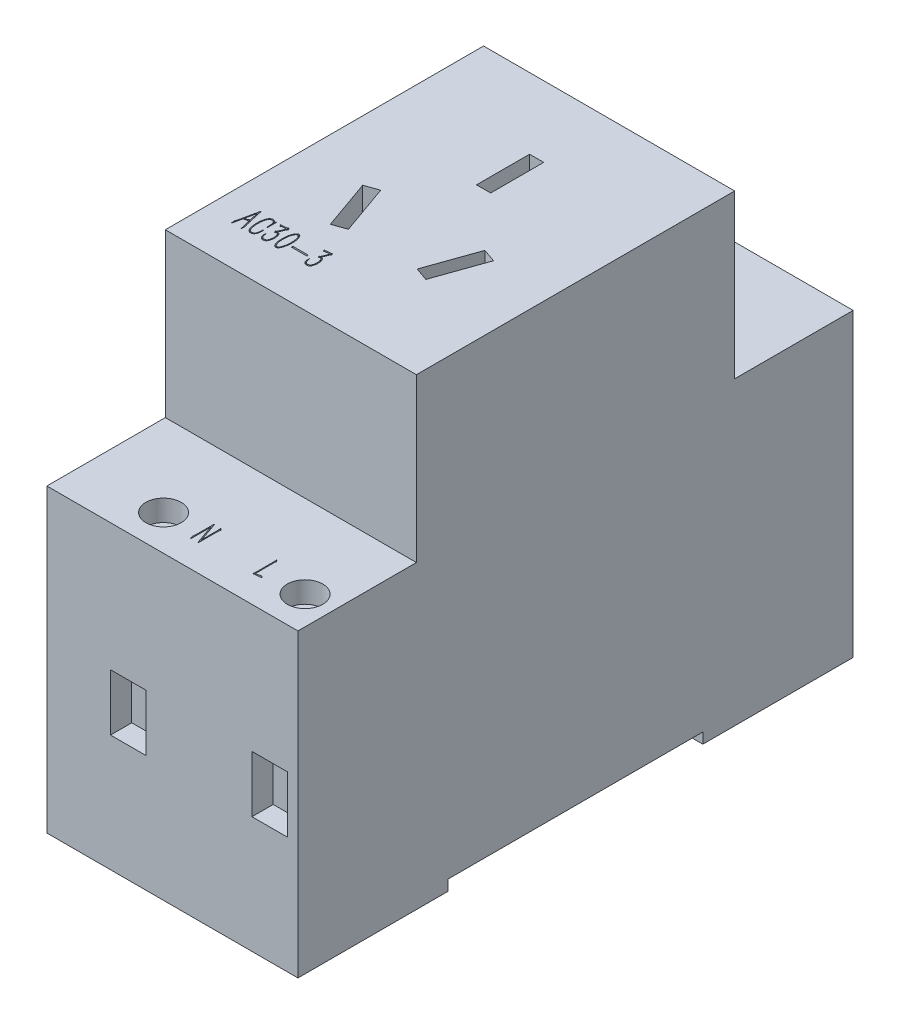
from build123d import *

# Parameters (mm, degrees)
EXTRUDE_1_DEPTH        = 17.75
SKETCH_2_R             = 2.5
CUT_EXTRUDE_1_DEPTH    = 3
SKETCH_3_W             = 5
SKETCH_3_H             = 8
CUT_EXTRUDE_2_DEPTH    = 3
PATTERN_LINEAR_1_COUNT = 3
PATTERN_LINEAR_1_PITCH = 20
SKETCH_5_R             = 3
CUT_EXTRUDE_3_DEPTH    = 3
SKETCH_6_W             = 5
SKETCH_6_H             = 8
CUT_EXTRUDE_4_DEPTH    = 3
SKETCH_9_W             = 2.164287236
SKETCH_9_H             = 0.217025357
CUT_EXTRUDE_6_DEPTH    = 0.3
CUT_EXTRUDE_7_DEPTH    = 0.3
SKETCH_14_W            = 2
SKETCH_14_H            = 7.5
CUT_EXTRUDE_8_DEPTH    = 5


with BuildPart() as part:
    # 草图1 → 凸台-拉伸1 (new, symmetric)
    with BuildSketch(Plane(origin=(0, 0, 0), x_dir=(0, 0, -1), z_dir=(1, 0, 0))):
        Polygon((-22.5, 32.75), (-22.5, 9.75), (-39.25, 9.75), (-39.25, -32.75), (-22.5, -32.75), (-18, -32.75), (-18, -31.25), (18, -31.25), (18, -32.75), (22.5, -32.75), (39.25, -32.75), (39.25, 9.75), (22.5, 9.75), (22.5, 32.75), align=None)
    extrude(amount=EXTRUDE_1_DEPTH, both=True)

    # 草图2 → 切除-拉伸1 (cut)
    with BuildSketch(Plane(origin=(0, 9.75, 0), x_dir=(1, 0, 0), z_dir=(0, 1, 0))):
        with Locations((-6.25, -34.25)):
            Circle(SKETCH_2_R)
    cut_extrude_1 = extrude(amount=-CUT_EXTRUDE_1_DEPTH, mode=Mode.SUBTRACT)

    # 草图3 → 切除-拉伸2 (cut)
    with BuildSketch(Plane.XY.offset(39.25)):
        with Locations((-6.25, -12.25)):
            Rectangle(SKETCH_3_W, SKETCH_3_H)
    cut_extrude_2 = extrude(amount=-CUT_EXTRUDE_2_DEPTH, mode=Mode.SUBTRACT)

    # 阵列(线性)1: 切除-拉伸1, 切除-拉伸2 ×3
    with Locations(*[(i * PATTERN_LINEAR_1_PITCH, 0, 0) for i in range(1, PATTERN_LINEAR_1_COUNT)]):
        add(cut_extrude_1, mode=Mode.SUBTRACT)
        add(cut_extrude_2, mode=Mode.SUBTRACT)

    # 草图5 → 切除-拉伸3 (cut)
    with BuildSketch(Plane(origin=(0, 9.75, 0), x_dir=(1, 0, 0), z_dir=(0, 1, 0))):
        with Locations((0, 30.875)):
            Circle(SKETCH_5_R)
    extrude(amount=-CUT_EXTRUDE_3_DEPTH, mode=Mode.SUBTRACT)

    # 草图6 → 切除-拉伸4 (cut)
    with BuildSketch(Plane(origin=(0, 0, -39.25), x_dir=(-1, 0, 0), z_dir=(0, 0, -1))):
        with Locations((0.051136376, -12.435750671)):
            Rectangle(SKETCH_6_W, SKETCH_6_H)
    extrude(amount=-CUT_EXTRUDE_4_DEPTH, mode=Mode.SUBTRACT)

    # 草图9 → 切除-拉伸6 (cut)
    # profile 1 of 6: a face of its own
    with BuildSketch(Plane(origin=(0, 32.75, 0), x_dir=(1, 0, 0), z_dir=(0, 1, 0))):
        with BuildLine():
            Line((-12.903846154, -15.517259749), (-13.588482847, -15.682825485))
            Line((-13.588482847, -15.682825485), (-13.749573833, -16.433091839))
            Line((-13.749573833, -16.433091839), (-13.825644577, -16.815682932))
            Line((-13.825644577, -16.815682932), (-13.855476241, -16.936501172))
            add(Edge.make_bspline(
                [(-13.855476241, -16.936501172), (-13.85864397, -16.945059256), (-13.863986048, -16.959491663), (-13.874037779, -16.97647154), (-13.88506828, -16.98490966), (-13.89738396, -16.98668845), (-13.906623365, -16.976009255), (-13.912117538, -16.962475291), (-13.913762051, -16.942614008), (-13.918331734, -16.916755356), (-13.921189485, -16.879763732), (-13.924468618, -16.851712187), (-13.926326444, -16.835819305)],
                knots=[0, 0, 0, 0, 1.226577759, 2.068508672, 2.595953142, 3.064162245, 3.560072257, 4.322224954, 5.029865969, 6.20926766, 7.852322798, 10, 10, 10, 10], degree=3))
            Line((-13.926326444, -16.835819305), (-13.950937567, -16.624760281))
            add(Edge.make_bspline(
                [(-13.950937567, -16.624760281), (-13.952528405, -16.607368105), (-13.955366473, -16.576340333), (-13.957860132, -16.535289216), (-13.958022043, -16.505671284), (-13.956586828, -16.480893098), (-13.949249484, -16.457460972), (-13.940532766, -16.441402394), (-13.936021734, -16.433091839)],
                knots=[0, 0, 0, 0, 1.603576797, 2.86079302, 3.773774944, 4.323462854, 5.1323669, 6, 6, 6, 6], degree=3))
            Line((-13.936021734, -16.433091839), (-13.91066482, -16.387598551))
            add(Edge.make_bspline(
                [(-13.91066482, -16.387598551), (-13.905234051, -16.375749704), (-13.892264208, -16.347452114), (-13.875841933, -16.295357842), (-13.858345759, -16.227530288), (-13.840715847, -16.149461978), (-13.823434547, -16.073859556), (-13.809628871, -16.012257796), (-13.79903273, -15.971395967), (-13.792141348, -15.951292584), (-13.78984658, -15.944598338)],
                knots=[0, 0, 0, 0, 0.679694972, 1.623257572, 2.844174753, 4.335796169, 5.799225578, 6.891200865, 7.630779852, 8, 8, 8, 8], degree=3))
            Line((-13.78984658, -15.944598338), (-13.271521415, -13.543895163))
            Line((-13.271521415, -13.543895163), (-13.201417004, -13.543895163))
            Line((-13.201417004, -13.543895163), (-12.712923503, -15.702961858))
            Line((-12.712923503, -15.702961858), (-12.652514383, -15.95503942))
            add(Edge.make_bspline(
                [(-12.652514383, -15.95503942), (-12.646454785, -15.98341577), (-12.635584754, -16.034318782), (-12.619043657, -16.101920209), (-12.605477696, -16.152543791), (-12.595938582, -16.180301036), (-12.592105263, -16.191455359)],
                knots=[0, 0, 0, 0, 1.425899692, 2.557855139, 3.420470246, 4, 4, 4, 4], degree=3))
            Line((-12.592105263, -16.191455359), (-12.557053058, -16.286916684))
            add(Edge.make_bspline(
                [(-12.557053058, -16.286916684), (-12.553018292, -16.300900397), (-12.545667104, -16.326378181), (-12.533109763, -16.360097705), (-12.520768714, -16.386133792), (-12.505055502, -16.40806158), (-12.489116806, -16.42451921), (-12.478115071, -16.441586532), (-12.476725188, -16.457519374), (-12.478652254, -16.472125844), (-12.480710195, -16.490728918), (-12.481711538, -16.514153121), (-12.484369821, -16.546426333), (-12.485544096, -16.570809028), (-12.486202855, -16.584487535)],
                knots=[0, 0, 0, 0, 1.645080438, 2.997272953, 4.065812928, 4.892545225, 6.029861332, 6.67147811, 7.124734071, 7.80170629, 8.338742145, 9.240009017, 10.451666043, 12, 12, 12, 12], degree=3))
            Line((-12.486202855, -16.584487535), (-12.506339229, -16.810462391))
            Line((-12.506339229, -16.810462391), (-12.516780311, -16.896228425))
            add(Edge.make_bspline(
                [(-12.516780311, -16.896228425), (-12.517276735, -16.905954831), (-12.51815915, -16.923243947), (-12.522413177, -16.9455144), (-12.525198303, -16.961680016), (-12.531065911, -16.973375317), (-12.542213852, -16.979158277), (-12.556034167, -16.975124678), (-12.566656291, -16.96114578), (-12.570012176, -16.948875905), (-12.57196889, -16.941721713)],
                knots=[0, 0, 0, 0, 1.663187075, 2.956388731, 3.874273883, 4.464983498, 5.130530035, 5.83179128, 6.735783313, 8, 8, 8, 8], degree=3))
            Line((-12.57196889, -16.941721713), (-12.607021095, -16.74035798))
            Line((-12.607021095, -16.74035798), (-12.903846154, -15.517259749))
        make_face()
        with BuildLine():
            Line((-12.914287236, -15.441189005), (-13.236469209, -14.027168123))
            Line((-13.236469209, -14.027168123), (-13.563871724, -15.506818666))
            add(Edge.make_bspline(
                [(-13.563871724, -15.506818666), (-13.535469746, -15.502440871), (-13.486436445, -15.494883025), (-13.41809484, -15.479873252), (-13.353414001, -15.462106351), (-13.295976991, -15.446213948), (-13.248533158, -15.430091389), (-13.217534101, -15.419423278), (-13.193983916, -15.408400165), (-13.181457775, -15.400042808), (-13.176060089, -15.396441509)],
                knots=[0, 0, 0, 0, 1.70172219, 2.937860729, 4.141475294, 5.674569601, 6.46612829, 7.108957565, 7.616037637, 8, 8, 8, 8], degree=3))
            Line((-13.176060089, -15.396441509), (-13.050021308, -15.310675474))
            Line((-13.050021308, -15.310675474), (-12.914287236, -15.441189005))
        make_face(mode=Mode.SUBTRACT)
    # profile 2 of 6: a face of its own
    with BuildSketch(Plane(origin=(0, 32.75, 0), x_dir=(1, 0, 0), z_dir=(0, 1, 0))):
        with BuildLine():
            Line((-10.904378862, -13.95631792), (-10.868580865, -13.659492862))
            Line((-10.868580865, -13.659492862), (-10.793255913, -13.659492862))
            Line((-10.793255913, -13.659492862), (-10.793255913, -15.003409333))
            Line((-10.793255913, -15.003409333), (-10.888717238, -15.003409333))
            add(Edge.make_bspline(
                [(-10.888717238, -15.003409333), (-10.888847848, -14.979044476), (-10.889121111, -14.928068106), (-10.892037466, -14.846552828), (-10.893899059, -14.753560188), (-10.897067392, -14.648656873), (-10.900044643, -14.536336662), (-10.911034693, -14.421325542), (-10.927835803, -14.305088994), (-10.953475464, -14.188496192), (-10.987192223, -14.07606274), (-11.027029876, -13.990486403), (-11.064226621, -13.930399112), (-11.094696643, -13.891337922), (-11.128660136, -13.858056011), (-11.17726281, -13.821844688), (-11.243643297, -13.785362539), (-11.302385557, -13.775029591), (-11.331717452, -13.769870019)],
                knots=[0, 0, 0, 0, 0.822473136, 1.720785642, 2.753326599, 3.962261781, 5.264018637, 6.545024146, 7.860049611, 9.226346671, 10.572050264, 11.814683136, 12.399128484, 12.954850798, 13.483022901, 13.998303406, 15.000488703, 16, 16, 16, 16], degree=3))
            add(Edge.make_bspline(
                [(-11.331717452, -13.769870019), (-11.354143012, -13.769271775), (-11.398899814, -13.768077803), (-11.465441677, -13.78153376), (-11.5295427, -13.806647815), (-11.591041957, -13.843038343), (-11.649627026, -13.88980444), (-11.701586298, -13.949631437), (-11.750993572, -14.018313232), (-11.791970529, -14.098736511), (-11.828282205, -14.185169663), (-11.862059777, -14.275097553), (-11.888257563, -14.368823702), (-11.916595397, -14.496167199), (-11.941791887, -14.654143397), (-11.959894779, -14.838036678), (-11.969357046, -15.009759192), (-11.972687096, -15.169969078), (-11.969397926, -15.323937552), (-11.963932839, -15.425540075), (-11.961165566, -15.476987002)],
                knots=[0, 0, 0, 0, 0.603095173, 1.203653813, 1.814626149, 2.451293107, 3.123130818, 3.825388984, 4.580186105, 5.398460658, 6.251023789, 7.107448911, 7.985514538, 8.871470416, 10.622993602, 12.29317529, 13.850163291, 15.257553743, 16.61134915, 18, 18, 18, 18], degree=3))
            add(Edge.make_bspline(
                [(-11.961165566, -15.476987002), (-11.957141866, -15.522995358), (-11.948908502, -15.617138444), (-11.935205272, -15.736565277), (-11.919361046, -15.837660378), (-11.903651215, -15.920968012), (-11.884068867, -16.01118983), (-11.862097319, -16.104859171), (-11.837368362, -16.194473438), (-11.814149264, -16.273940978), (-11.7907446, -16.338840519), (-11.759948785, -16.405831128), (-11.716377041, -16.476136539), (-11.659774013, -16.551912506), (-11.596301728, -16.614607183), (-11.528252898, -16.662330049), (-11.452330352, -16.690068949), (-11.399313201, -16.693233701), (-11.371990198, -16.694864692)],
                knots=[0, 0, 0, 0, 1.515526627, 3.101096572, 3.943353373, 4.87293365, 5.882541642, 6.972773351, 8.029529644, 8.932786276, 9.68898916, 10.291221641, 11.348890653, 12.39638072, 13.388602443, 14.264213047, 15.105442077, 16, 16, 16, 16], degree=3))
            add(Edge.make_bspline(
                [(-11.371990198, -16.694864692), (-11.346527409, -16.695208185), (-11.294674824, -16.695907677), (-11.217443973, -16.676266369), (-11.14247369, -16.644890815), (-11.072446322, -16.598563452), (-11.010660198, -16.537059595), (-10.958112807, -16.460530153), (-10.916442554, -16.369383439), (-10.88764843, -16.265259683), (-10.864417756, -16.152922142), (-10.8493168, -16.057057999), (-10.838631024, -15.984603481), (-10.831716929, -15.941164633), (-10.827381182, -15.908790746), (-10.824836991, -15.891148616), (-10.823833369, -15.884189218)],
                knots=[0, 0, 0, 0, 0.974493461, 1.984464659, 3.032762083, 4.086915356, 5.187622472, 6.361151533, 7.634420725, 9.018373663, 10.501751059, 12.040324543, 12.745324753, 13.31527632, 13.729892907, 14, 14, 14, 14], degree=3))
            Line((-10.823833369, -15.884189218), (-10.798476454, -15.617941615))
            Line((-10.798476454, -15.617941615), (-10.717930961, -15.622416365))
            add(Edge.make_bspline(
                [(-10.717930961, -15.622416365), (-10.717830566, -15.647277054), (-10.71764784, -15.692525025), (-10.7187584, -15.754169806), (-10.718975964, -15.803166407), (-10.720973755, -15.843168215), (-10.72227045, -15.880744115), (-10.725535527, -15.922752306), (-10.729959326, -15.972728249), (-10.737927194, -16.04648763), (-10.745948906, -16.134889966), (-10.75717445, -16.233853206), (-10.773886367, -16.330548493), (-10.805245267, -16.431476186), (-10.84841565, -16.537427687), (-10.89717708, -16.621968331), (-10.943658318, -16.684516727), (-10.984338133, -16.726189058), (-11.029478025, -16.764207942), (-11.079787196, -16.79633569), (-11.132877233, -16.82334811), (-11.188190392, -16.842512316), (-11.244270908, -16.856907128), (-11.282657255, -16.859751443), (-11.301885787, -16.86117622)],
                knots=[0, 0, 0, 0, 1.082557886, 1.97032136, 2.684891572, 3.215786613, 3.714233695, 4.322010655, 5.050226996, 5.899051791, 7.552532718, 8.915438272, 10.236158893, 11.818471953, 13.507262255, 15.209909354, 16.052150521, 16.894322113, 17.739826851, 18.616631911, 19.488074199, 20.326969254, 21.161943562, 22, 22, 22, 22], degree=3))
            add(Edge.make_bspline(
                [(-11.301885787, -16.86117622), (-11.334050628, -16.862585178), (-11.399565549, -16.865455014), (-11.496210279, -16.843418682), (-11.586608298, -16.808503478), (-11.655440284, -16.768347901), (-11.704540688, -16.728515916), (-11.739551677, -16.691874136), (-11.774934462, -16.650134448), (-11.808813171, -16.601399335), (-11.842696464, -16.546904213), (-11.874262394, -16.485821366), (-11.904841922, -16.419016663), (-11.945779572, -16.320406991), (-11.989917752, -16.183864194), (-12.025126669, -16.038146746), (-12.048806336, -15.912130644), (-12.063059337, -15.809238509), (-12.076783779, -15.700396125), (-12.091312004, -15.548809972), (-12.103284604, -15.360340153), (-12.109405029, -15.137664793), (-12.10295544, -14.91702744), (-12.085595764, -14.770629558), (-12.076763264, -14.696143192)],
                knots=[0, 0, 0, 0, 0.828879423, 1.68830212, 2.536676829, 3.328986324, 3.73541648, 4.167069034, 4.63682846, 5.148487351, 5.699502401, 6.294435402, 6.924061178, 7.598240742, 9.053084533, 10.627089957, 11.470192478, 12.366164513, 13.311378798, 14.305576584, 16.301598498, 18.191207909, 20.062109376, 22, 22, 22, 22], degree=3))
            add(Edge.make_bspline(
                [(-12.076763264, -14.696143192), (-12.066684952, -14.621572919), (-12.046627654, -14.4731673), (-12.001872225, -14.293125126), (-11.959270715, -14.157641548), (-11.926168816, -14.067297649), (-11.891019476, -13.988695545), (-11.854984339, -13.920173424), (-11.816294568, -13.86049449), (-11.775616892, -13.80689251), (-11.730194445, -13.760843292), (-11.683968265, -13.719981273), (-11.63754957, -13.686636805), (-11.594886975, -13.658971495), (-11.557311696, -13.636621594), (-11.510656473, -13.617115821), (-11.449222561, -13.602097789), (-11.39868657, -13.603541579), (-11.371990198, -13.604304283)],
                knots=[0, 0, 0, 0, 2.546659555, 5.068220541, 6.268960188, 7.35572531, 8.324149365, 9.182807276, 9.974388089, 10.730435642, 11.456747585, 12.160764052, 12.817438768, 13.389505863, 13.883390408, 14.294592413, 15.099093679, 16, 16, 16, 16], degree=3))
            add(Edge.make_bspline(
                [(-11.371990198, -13.604304283), (-11.344691369, -13.608978906), (-11.288740769, -13.618559829), (-11.206921855, -13.64857607), (-11.126119375, -13.69001941), (-11.056179263, -13.74852705), (-10.994316757, -13.808975937), (-10.963427117, -13.854634298), (-10.949126358, -13.875772427)],
                knots=[0, 0, 0, 0, 0.959137923, 1.965811105, 3.01152559, 4.09188384, 5.116612916, 6, 6, 6, 6], degree=3))
            Line((-10.949126358, -13.875772427), (-10.904378862, -13.95631792))
        make_face()
    # profile 3 of 6: a face of its own
    with BuildSketch(Plane(origin=(0, 32.75, 0), x_dir=(1, 0, 0), z_dir=(0, 1, 0))):
        with BuildLine():
            add(Edge.make_bspline(
                [(-9.699179629, -14.832623056), (-9.688007995, -14.809496011), (-9.666487303, -14.764944784), (-9.635097354, -14.700591841), (-9.605813392, -14.641507765), (-9.580766768, -14.586681307), (-9.55741193, -14.537321203), (-9.536611422, -14.492899036), (-9.518638382, -14.453400283), (-9.499716567, -14.409548209), (-9.480091755, -14.36380032), (-9.461093289, -14.318991432), (-9.44727738, -14.286983409), (-9.440134527, -14.270050493), (-9.437406776, -14.263584061)],
                knots=[0, 0, 0, 0, 1.475873638, 2.843077615, 4.114458223, 5.26483622, 6.306479236, 7.252326145, 8.083448402, 8.799989154, 9.996708352, 10.943956596, 11.596712522, 12, 12, 12, 12], degree=3))
            Line((-9.437406776, -14.263584061), (-9.276315789, -13.83549968))
            add(Edge.make_bspline(
                [(-9.276315789, -13.83549968), (-9.311351946, -13.838928371), (-9.387799113, -13.846409606), (-9.48535917, -13.852349721), (-9.566476861, -13.856675542), (-9.622137467, -13.861339664), (-9.670877275, -13.865699087), (-9.700924265, -13.869015711), (-9.714841253, -13.870551886)],
                knots=[0, 0, 0, 0, 1.440114021, 3.142257811, 3.998086789, 4.76330671, 5.427195687, 6, 6, 6, 6], degree=3))
            Line((-9.714841253, -13.870551886), (-9.865491157, -13.8959088))
            add(Edge.make_bspline(
                [(-9.865491157, -13.8959088), (-9.872222602, -13.897323976), (-9.890587823, -13.901184961), (-9.924550787, -13.911728117), (-9.973463727, -13.924693766), (-10.010693143, -13.935356299), (-10.031802685, -13.941402088)],
                knots=[0, 0, 0, 0, 0.478461291, 1.305373098, 2.472113022, 4, 4, 4, 4], degree=3))
            Line((-10.031802685, -13.941402088), (-10.081770722, -13.961538462))
            Line((-10.081770722, -13.961538462), (-10.207809504, -13.77509056))
            add(Edge.make_bspline(
                [(-10.207809504, -13.77509056), (-10.213131701, -13.767790732), (-10.222217261, -13.755329146), (-10.229759894, -13.737993825), (-10.235358692, -13.72595056), (-10.230340656, -13.713822976), (-10.210497867, -13.715641528), (-10.19551626, -13.726278227), (-10.17638056, -13.736512097), (-10.154364508, -13.737951427), (-10.127673257, -13.739517838), (-10.108110909, -13.73647747), (-10.097432346, -13.734817814)],
                knots=[0, 0, 0, 0, 1.323589942, 2.259509366, 2.829398404, 3.190947808, 3.965341466, 5.19662492, 6.050472624, 7.088782, 8.410843841, 10, 10, 10, 10], degree=3))
            Line((-10.097432346, -13.734817814), (-9.936341359, -13.729597273))
            Line((-9.936341359, -13.729597273), (-9.301672704, -13.65427232))
            Line((-9.301672704, -13.65427232), (-9.251704667, -13.608779033))
            Line((-9.251704667, -13.608779033), (-9.21143192, -13.568506286))
            add(Edge.make_bspline(
                [(-9.21143192, -13.568506286), (-9.210182944, -13.569993019), (-9.205062836, -13.576087798), (-9.194040159, -13.590590628), (-9.174440297, -13.613891368), (-9.159621929, -13.633308961), (-9.1510228, -13.64457703)],
                knots=[0, 0, 0, 0, 0.23984028, 0.983211964, 2.249351781, 4, 4, 4, 4], degree=3))
            Line((-9.1510228, -13.64457703), (-9.054815683, -13.76539527))
            add(Edge.make_bspline(
                [(-9.054815683, -13.76539527), (-9.048355223, -13.773783312), (-9.037618963, -13.787722909), (-9.029653937, -13.810016338), (-9.037815652, -13.82512065), (-9.049217075, -13.838067786), (-9.067698844, -13.853618288), (-9.082342046, -13.864439317), (-9.09061368, -13.870551886)],
                knots=[0, 0, 0, 0, 1.419029252, 2.358201718, 2.827787952, 3.596253847, 4.642174893, 6, 6, 6, 6], degree=3))
            Line((-9.09061368, -13.870551886), (-9.145802259, -13.916045174))
            add(Edge.make_bspline(
                [(-9.145802259, -13.916045174), (-9.161930793, -13.956578471), (-9.192532423, -14.033484713), (-9.236623308, -14.142935579), (-9.276968269, -14.240253133), (-9.31239394, -14.326287286), (-9.344932917, -14.400060178), (-9.371795766, -14.462658281), (-9.395981072, -14.512879656), (-9.410774072, -14.542278227), (-9.417270403, -14.555188579)],
                knots=[0, 0, 0, 0, 1.507300768, 2.859891598, 4.076963614, 5.147345159, 6.074452096, 6.862861548, 7.500626815, 8, 8, 8, 8], degree=3))
            Line((-9.417270403, -14.555188579), (-9.568666098, -14.842318346))
            add(Edge.make_bspline(
                [(-9.568666098, -14.842318346), (-9.55077064, -14.8408895), (-9.51649768, -14.838153008), (-9.46419291, -14.832929177), (-9.407203857, -14.84011451), (-9.357219528, -14.860105118), (-9.314691589, -14.884771996), (-9.280613943, -14.909409359), (-9.248057892, -14.941431036), (-9.214860727, -14.979074857), (-9.181586015, -15.024004711), (-9.150998082, -15.078423989), (-9.119156435, -15.140565939), (-9.079334787, -15.235269274), (-9.0363058, -15.361984268), (-9.010162087, -15.52113901), (-8.997245092, -15.680595693), (-8.995348784, -15.786714377), (-8.994406563, -15.839441722)],
                knots=[0, 0, 0, 0, 0.660541429, 1.265053373, 1.928435853, 2.750244091, 3.225390118, 3.735570922, 4.291687282, 4.900607759, 5.580848831, 6.342918567, 7.193367346, 8.147740655, 10.119512469, 12.097611575, 14.061014616, 16, 16, 16, 16], degree=3))
            add(Edge.make_bspline(
                [(-8.994406563, -15.839441722), (-8.996396925, -15.880721601), (-9.000177974, -15.959140118), (-9.009315874, -16.069951499), (-9.022952287, -16.167167426), (-9.042811388, -16.276769954), (-9.077834368, -16.397859178), (-9.121100816, -16.509575171), (-9.162181655, -16.590060186), (-9.19680367, -16.643429303), (-9.234724653, -16.6911748), (-9.275475694, -16.732957284), (-9.317865185, -16.767293719), (-9.359006124, -16.796824178), (-9.400636578, -16.817695346), (-9.454530928, -16.835131144), (-9.520391111, -16.847149747), (-9.572845914, -16.849557621), (-9.598497763, -16.850735137)],
                knots=[0, 0, 0, 0, 1.512752116, 2.8737433, 4.067977017, 5.104892351, 6.948544146, 8.672095895, 9.482011449, 10.251829035, 10.996496654, 11.710742831, 12.38300564, 12.991319199, 13.561044299, 14.079002633, 15.060579187, 16, 16, 16, 16], degree=3))
            add(Edge.make_bspline(
                [(-9.598497763, -16.850735137), (-9.620377698, -16.851108091), (-9.662472183, -16.85182561), (-9.723529129, -16.846855109), (-9.779138583, -16.83547854), (-9.831291016, -16.820002461), (-9.88013346, -16.795528833), (-9.92678744, -16.760568347), (-9.97375304, -16.717518531), (-10.01878365, -16.664688541), (-10.059996278, -16.604162867), (-10.096031514, -16.537213204), (-10.125971834, -16.464787362), (-10.155736289, -16.361715429), (-10.180964188, -16.229916753), (-10.185458607, -16.123212995), (-10.18767313, -16.070637119)],
                knots=[0, 0, 0, 0, 0.828828519, 1.594571005, 2.314948186, 2.97625877, 3.650192192, 4.371738268, 5.178272596, 6.059897072, 6.995131469, 7.947518938, 8.935744196, 9.957858231, 12.008325587, 14, 14, 14, 14], degree=3))
            Line((-10.18767313, -16.070637119), (-10.192893671, -15.874493927))
            Line((-10.192893671, -15.874493927), (-10.137705093, -15.874493927))
            add(Edge.make_bspline(
                [(-10.137705093, -15.874493927), (-10.133484895, -15.903580402), (-10.125402843, -15.959283581), (-10.113646568, -16.039649112), (-10.101470256, -16.112907738), (-10.087747893, -16.199602325), (-10.064893736, -16.296950996), (-10.026391451, -16.401723578), (-9.974176959, -16.4902498), (-9.912870717, -16.563201481), (-9.841169414, -16.616153574), (-9.764411982, -16.649554655), (-9.686182303, -16.665325211), (-9.634350078, -16.665129149), (-9.608938845, -16.665033028)],
                knots=[0, 0, 0, 0, 0.994021113, 1.903638599, 2.746793397, 3.505624798, 4.871908371, 6.122639036, 7.264652637, 8.331625701, 9.323760524, 10.250011688, 11.142051883, 12, 12, 12, 12], degree=3))
            add(Edge.make_bspline(
                [(-9.608938845, -16.665033028), (-9.58849589, -16.663270178), (-9.548456646, -16.659817489), (-9.490395396, -16.646672736), (-9.436700419, -16.624243739), (-9.386506286, -16.595561937), (-9.34132656, -16.558159879), (-9.300664563, -16.514088042), (-9.266229052, -16.461731756), (-9.227636545, -16.381577308), (-9.190130551, -16.271073813), (-9.16191027, -16.130715034), (-9.143546871, -15.987545354), (-9.134919846, -15.845092224), (-9.133744369, -15.704751157), (-9.145284256, -15.612902298), (-9.1510228, -15.567227786)],
                knots=[0, 0, 0, 0, 0.647840119, 1.268849254, 1.871153999, 2.479976942, 3.088343857, 3.716462885, 4.367721208, 5.059616847, 6.52246665, 8.039623249, 9.575767262, 11.078710543, 12.547304005, 14, 14, 14, 14], degree=3))
            add(Edge.make_bspline(
                [(-9.1510228, -15.567227786), (-9.159046982, -15.517997394), (-9.174908942, -15.420680239), (-9.211600718, -15.303871136), (-9.247731885, -15.216647063), (-9.279967159, -15.158126652), (-9.316504434, -15.105854079), (-9.35789187, -15.0620123), (-9.399847121, -15.02603529), (-9.441959003, -15.002028728), (-9.483546708, -14.989675469), (-9.51019516, -14.992391399), (-9.523172811, -14.993714042)],
                knots=[0, 0, 0, 0, 2.019199264, 3.991492233, 4.943861116, 5.841091039, 6.693606335, 7.520378909, 8.278781735, 8.923571305, 9.475785111, 10, 10, 10, 10], degree=3))
            Line((-9.523172811, -14.993714042), (-9.603718304, -15.003409333))
            Line((-9.603718304, -15.003409333), (-9.638770509, -15.069038994))
            add(Edge.make_bspline(
                [(-9.638770509, -15.069038994), (-9.643449035, -15.077218085), (-9.651604853, -15.091476247), (-9.662749691, -15.110322325), (-9.671650935, -15.121360908), (-9.678407181, -15.130876976), (-9.688173896, -15.127675758), (-9.694455865, -15.116736788), (-9.70449817, -15.100633091), (-9.711030596, -15.086802366), (-9.714841253, -15.078734285)],
                knots=[0, 0, 0, 0, 1.659028505, 2.892093886, 3.763458346, 4.288089223, 4.647361994, 5.327919393, 6.441255868, 8, 8, 8, 8], degree=3))
            Line((-9.714841253, -15.078734285), (-9.795386746, -14.92286384))
            add(Edge.make_bspline(
                [(-9.795386746, -14.92286384), (-9.801208731, -14.913905413), (-9.811358111, -14.89828832), (-9.80695808, -14.880486129), (-9.805082037, -14.872895802)],
                knots=[0, 0, 0, 0, 1.147259222, 2, 2, 2, 2], degree=3))
            Line((-9.805082037, -14.872895802), (-9.76480929, -14.857234179))
            Line((-9.76480929, -14.857234179), (-9.699179629, -14.832623056))
        make_face()
    # profile 4 of 6: a face of its own
    with BuildSketch(Plane(origin=(0, 32.75, 0), x_dir=(1, 0, 0), z_dir=(0, 1, 0))):
        with BuildLine():
            add(Edge.make_bspline(
                [(-8.404485404, -15.179416152), (-8.402055012, -15.131169164), (-8.397075596, -15.032320124), (-8.383539112, -14.880807899), (-8.363572356, -14.722745507), (-8.340418532, -14.560418531), (-8.308379877, -14.400062182), (-8.267376398, -14.247564625), (-8.215032182, -14.106567459), (-8.162800844, -13.998299694), (-8.118646844, -13.918919111), (-8.086520593, -13.866113237), (-8.05595694, -13.818491335), (-8.025844727, -13.777116713), (-7.996289493, -13.741885261), (-7.969032067, -13.711336604), (-7.941523275, -13.687553006), (-7.907023267, -13.663969388), (-7.865029322, -13.642935301), (-7.816366196, -13.624534304), (-7.769541628, -13.613889912), (-7.73903773, -13.613963889), (-7.72432346, -13.613999574)],
                knots=[0, 0, 0, 0, 1.583211401, 3.243703523, 4.983978234, 6.804605119, 8.6166428, 10.340282122, 11.974804003, 13.53820457, 14.274983449, 14.951299633, 15.563740824, 16.129235462, 16.626851747, 17.070813204, 17.469389546, 17.815167281, 18.438300608, 19.002855301, 19.519003895, 20, 20, 20, 20], degree=3))
            add(Edge.make_bspline(
                [(-7.72432346, -13.613999574), (-7.710253274, -13.616459908), (-7.680534851, -13.621656516), (-7.636598894, -13.640978515), (-7.589967204, -13.666674607), (-7.540353527, -13.699979022), (-7.490818991, -13.744758612), (-7.444912298, -13.804067884), (-7.402293658, -13.876501231), (-7.349331055, -13.991138172), (-7.29096806, -14.146520746), (-7.245141726, -14.309670215), (-7.215374367, -14.445892431), (-7.195961287, -14.554575747), (-7.18052478, -14.669823427), (-7.163948421, -14.831839255), (-7.149165355, -15.039446829), (-7.146782777, -15.206733422), (-7.145589175, -15.290539101)],
                knots=[0, 0, 0, 0, 0.36369769, 0.768186139, 1.217229854, 1.724510149, 2.290946358, 2.914777825, 3.632489608, 4.433551378, 6.137860108, 7.866765886, 8.757390638, 9.699141408, 10.686159515, 11.726895222, 13.859299765, 16, 16, 16, 16], degree=3))
            add(Edge.make_bspline(
                [(-7.145589175, -15.290539101), (-7.150154718, -15.357691673), (-7.15953786, -15.495704217), (-7.181859816, -15.70707598), (-7.218674837, -15.926967987), (-7.265001874, -16.112195287), (-7.309811645, -16.259675847), (-7.347811882, -16.366096437), (-7.390329951, -16.46659545), (-7.435709948, -16.560198932), (-7.482919303, -16.643523155), (-7.531788115, -16.713539633), (-7.583427645, -16.767466406), (-7.636480487, -16.806202039), (-7.688279775, -16.832452611), (-7.737773742, -16.849236861), (-7.784907023, -16.858553366), (-7.815530067, -16.856798046), (-7.830225868, -16.855955679)],
                knots=[0, 0, 0, 0, 1.760488992, 3.618172134, 5.557361062, 7.587083219, 8.607294374, 9.588398617, 10.541277716, 11.460251193, 12.307925722, 13.044175775, 13.687957546, 14.251129358, 14.754223989, 15.200440537, 15.616296545, 16, 16, 16, 16], degree=3))
            add(Edge.make_bspline(
                [(-7.830225868, -16.855955679), (-7.844268116, -16.853981824), (-7.873854049, -16.849823063), (-7.918450431, -16.83232251), (-7.964891658, -16.80535887), (-8.014470863, -16.769815252), (-8.064394383, -16.720983648), (-8.11246779, -16.657823334), (-8.158569544, -16.579991114), (-8.202381479, -16.488971783), (-8.243531571, -16.387591742), (-8.279563665, -16.278201112), (-8.312946683, -16.163249762), (-8.339695472, -16.043062084), (-8.361706895, -15.921593071), (-8.378977465, -15.802194541), (-8.391095534, -15.686263306), (-8.39763534, -15.574261754), (-8.399922139, -15.467046052), (-8.40233896, -15.365622522), (-8.403850897, -15.270406715), (-8.404279109, -15.208999618), (-8.404485404, -15.179416152)],
                knots=[0, 0, 0, 0, 0.451175502, 0.950591959, 1.515271951, 2.162531354, 2.891688268, 3.734081857, 4.687580886, 5.773002708, 6.954198864, 8.17563603, 9.445923076, 10.771603705, 12.101713585, 13.383756751, 14.619631726, 15.819374781, 16.961914306, 18.040825747, 19.056148764, 20, 20, 20, 20], degree=3))
        make_face()
        with BuildLine():
            add(Edge.make_bspline(
                [(-8.273226081, -15.189857234), (-8.273756826, -15.213970051), (-8.274883874, -15.265174096), (-8.275955732, -15.346727177), (-8.273956108, -15.437473764), (-8.270539411, -15.571384315), (-8.257995395, -15.7463886), (-8.225935178, -15.956489317), (-8.180147053, -16.159955169), (-8.129692676, -16.319394452), (-8.082720039, -16.433052669), (-8.046675247, -16.503593055), (-8.008754823, -16.560580067), (-7.969025706, -16.603987537), (-7.928838716, -16.634749719), (-7.891282488, -16.656731719), (-7.855693291, -16.671826187), (-7.831841974, -16.67379474), (-7.820530577, -16.674728319)],
                knots=[0, 0, 0, 0, 0.705717407, 1.498604912, 2.386138873, 3.361274458, 5.418191474, 7.514713171, 9.57394393, 11.515405308, 12.398906158, 13.169972934, 13.829695216, 14.395845116, 14.883250105, 15.303691084, 15.669778158, 16, 16, 16, 16], degree=3))
            add(Edge.make_bspline(
                [(-7.820530577, -16.674728319), (-7.810058765, -16.674593632), (-7.787565451, -16.674304325), (-7.752373608, -16.665841293), (-7.715376635, -16.648026329), (-7.674338683, -16.624615909), (-7.632179435, -16.588586643), (-7.590567505, -16.539348545), (-7.549781539, -16.476244239), (-7.509105169, -16.401625402), (-7.470628275, -16.318607591), (-7.436161074, -16.230653163), (-7.406165373, -16.139859638), (-7.373724766, -16.012833355), (-7.340374259, -15.848085172), (-7.310417881, -15.646900728), (-7.290551816, -15.448504119), (-7.282278646, -15.286650429), (-7.279977366, -15.158533951), (-7.281889864, -15.056584149), (-7.285498224, -14.947181255), (-7.289629831, -14.87164639), (-7.29176433, -14.832623056)],
                knots=[0, 0, 0, 0, 0.308126263, 0.661851094, 1.055455993, 1.515432549, 2.051181639, 2.679899785, 3.409545513, 4.262246801, 5.183512362, 6.104777924, 7.045624675, 8.000099589, 9.967578284, 11.997814557, 13.993544283, 15.842664909, 16.77344086, 17.770161498, 18.848005724, 20, 20, 20, 20], degree=3))
            add(Edge.make_bspline(
                [(-7.29176433, -14.832623056), (-7.295361151, -14.796066133), (-7.302342529, -14.725109673), (-7.314616316, -14.622560938), (-7.329846761, -14.527386101), (-7.351307573, -14.410132694), (-7.385950951, -14.269440377), (-7.433669756, -14.135497041), (-7.47482667, -14.034368551), (-7.510202211, -13.970294107), (-7.546181929, -13.91591731), (-7.586164445, -13.87442096), (-7.625082869, -13.842084379), (-7.66171237, -13.81791592), (-7.695924452, -13.800851831), (-7.718962652, -13.796997303), (-7.729544002, -13.795226934)],
                knots=[0, 0, 0, 0, 1.302834758, 2.528783491, 3.662347304, 4.720685654, 6.75648594, 8.792057095, 9.759925264, 10.624039914, 11.384659521, 12.06448684, 12.659424566, 13.175428451, 13.621277708, 14, 14, 14, 14], degree=3))
            add(Edge.make_bspline(
                [(-7.729544002, -13.795226934), (-7.741046472, -13.796063955), (-7.765217254, -13.797822835), (-7.802116146, -13.809133002), (-7.841279764, -13.826818368), (-7.884306405, -13.851350039), (-7.929127854, -13.890723067), (-7.974385547, -13.948357042), (-8.02121548, -14.024804688), (-8.070093394, -14.118911664), (-8.116794954, -14.229788324), (-8.156473988, -14.356787568), (-8.190761902, -14.497760912), (-8.216588401, -14.64873376), (-8.237451039, -14.79983307), (-8.253718055, -14.941858302), (-8.26618014, -15.07038295), (-8.270967295, -15.151556186), (-8.273226081, -15.189857234)],
                knots=[0, 0, 0, 0, 0.347392606, 0.729995465, 1.156884588, 1.644891073, 2.219813456, 2.945627096, 3.849684979, 4.924243867, 6.145708801, 7.477723151, 8.938118981, 10.524254447, 12.100980159, 13.544449593, 14.841364989, 16, 16, 16, 16], degree=3))
        make_face(mode=Mode.SUBTRACT)
    # profile 5 of 6: a face of its own
    with BuildSketch(Plane(origin=(0, 32.75, 0), x_dir=(1, 0, 0), z_dir=(0, 1, 0))):
        with Locations((-5.61373322, -15.610110804)):
            Rectangle(SKETCH_9_W, SKETCH_9_H)
    # profile 6 of 6: a face of its own
    with BuildSketch(Plane(origin=(0, 32.75, 0), x_dir=(1, 0, 0), z_dir=(0, 1, 0))):
        with BuildLine():
            add(Edge.make_bspline(
                [(-3.541924142, -14.832623056), (-3.530752508, -14.809496011), (-3.509231816, -14.764944784), (-3.477841867, -14.700591841), (-3.448557905, -14.641507765), (-3.423511282, -14.586681307), (-3.400156443, -14.537321203), (-3.379355935, -14.492899036), (-3.361382896, -14.453400283), (-3.342461081, -14.409548209), (-3.322836268, -14.36380032), (-3.303837802, -14.318991432), (-3.290021894, -14.286983409), (-3.28287904, -14.270050493), (-3.280151289, -14.263584061)],
                knots=[0, 0, 0, 0, 1.475873638, 2.843077615, 4.114458223, 5.26483622, 6.306479236, 7.252326145, 8.083448402, 8.799989154, 9.996708352, 10.943956596, 11.596712522, 12, 12, 12, 12], degree=3))
            Line((-3.280151289, -14.263584061), (-3.119060303, -13.83549968))
            add(Edge.make_bspline(
                [(-3.119060303, -13.83549968), (-3.154096459, -13.838928371), (-3.230543626, -13.846409606), (-3.328103683, -13.852349721), (-3.409221375, -13.856675542), (-3.46488198, -13.861339664), (-3.513621788, -13.865699087), (-3.543668778, -13.869015711), (-3.557585766, -13.870551886)],
                knots=[0, 0, 0, 0, 1.440114021, 3.142257811, 3.998086789, 4.76330671, 5.427195687, 6, 6, 6, 6], degree=3))
            Line((-3.557585766, -13.870551886), (-3.70823567, -13.8959088))
            add(Edge.make_bspline(
                [(-3.70823567, -13.8959088), (-3.714967115, -13.897323976), (-3.733332336, -13.901184961), (-3.7672953, -13.911728117), (-3.81620824, -13.924693766), (-3.853437656, -13.935356299), (-3.874547198, -13.941402088)],
                knots=[0, 0, 0, 0, 0.478461291, 1.305373098, 2.472113022, 4, 4, 4, 4], degree=3))
            Line((-3.874547198, -13.941402088), (-3.924515235, -13.961538462))
            Line((-3.924515235, -13.961538462), (-4.050554017, -13.77509056))
            add(Edge.make_bspline(
                [(-4.050554017, -13.77509056), (-4.055876214, -13.767790732), (-4.064961774, -13.755329146), (-4.072504407, -13.737993825), (-4.078103205, -13.72595056), (-4.073085169, -13.713822976), (-4.05324238, -13.715641528), (-4.038260773, -13.726278227), (-4.019125073, -13.736512097), (-3.997109022, -13.737951427), (-3.970417771, -13.739517838), (-3.950855423, -13.73647747), (-3.940176859, -13.734817814)],
                knots=[0, 0, 0, 0, 1.323589942, 2.259509366, 2.829398404, 3.190947808, 3.965341466, 5.19662492, 6.050472624, 7.088782, 8.410843841, 10, 10, 10, 10], degree=3))
            Line((-3.940176859, -13.734817814), (-3.779085873, -13.729597273))
            Line((-3.779085873, -13.729597273), (-3.144417217, -13.65427232))
            Line((-3.144417217, -13.65427232), (-3.09444918, -13.608779033))
            Line((-3.09444918, -13.608779033), (-3.054176433, -13.568506286))
            add(Edge.make_bspline(
                [(-3.054176433, -13.568506286), (-3.052927457, -13.569993019), (-3.047807349, -13.576087798), (-3.036784672, -13.590590628), (-3.01718481, -13.613891368), (-3.002366442, -13.633308961), (-2.993767313, -13.64457703)],
                knots=[0, 0, 0, 0, 0.23984028, 0.983211964, 2.249351781, 4, 4, 4, 4], degree=3))
            Line((-2.993767313, -13.64457703), (-2.897560196, -13.76539527))
            add(Edge.make_bspline(
                [(-2.897560196, -13.76539527), (-2.891099736, -13.773783312), (-2.880363476, -13.787722909), (-2.87239845, -13.810016338), (-2.880560165, -13.82512065), (-2.891961588, -13.838067786), (-2.910443357, -13.853618288), (-2.925086559, -13.864439317), (-2.933358193, -13.870551886)],
                knots=[0, 0, 0, 0, 1.419029252, 2.358201718, 2.827787952, 3.596253847, 4.642174893, 6, 6, 6, 6], degree=3))
            Line((-2.933358193, -13.870551886), (-2.988546772, -13.916045174))
            add(Edge.make_bspline(
                [(-2.988546772, -13.916045174), (-3.004675306, -13.956578471), (-3.035276936, -14.033484713), (-3.079367821, -14.142935579), (-3.119712782, -14.240253133), (-3.155138453, -14.326287286), (-3.18767743, -14.400060178), (-3.214540279, -14.462658281), (-3.238725585, -14.512879656), (-3.253518585, -14.542278227), (-3.260014916, -14.555188579)],
                knots=[0, 0, 0, 0, 1.507300768, 2.859891598, 4.076963614, 5.147345159, 6.074452096, 6.862861548, 7.500626815, 8, 8, 8, 8], degree=3))
            Line((-3.260014916, -14.555188579), (-3.411410612, -14.842318346))
            add(Edge.make_bspline(
                [(-3.411410612, -14.842318346), (-3.393515153, -14.8408895), (-3.359242193, -14.838153008), (-3.306937423, -14.832929177), (-3.24994837, -14.84011451), (-3.199964041, -14.860105118), (-3.157436102, -14.884771996), (-3.123358456, -14.909409359), (-3.090802405, -14.941431036), (-3.05760524, -14.979074857), (-3.024330528, -15.024004711), (-2.993742595, -15.078423989), (-2.961900948, -15.140565939), (-2.9220793, -15.235269274), (-2.879050313, -15.361984268), (-2.8529066, -15.52113901), (-2.839989605, -15.680595693), (-2.838093297, -15.786714377), (-2.837151076, -15.839441722)],
                knots=[0, 0, 0, 0, 0.660541429, 1.265053373, 1.928435853, 2.750244091, 3.225390118, 3.735570922, 4.291687282, 4.900607759, 5.580848831, 6.342918567, 7.193367346, 8.147740655, 10.119512469, 12.097611575, 14.061014616, 16, 16, 16, 16], degree=3))
            add(Edge.make_bspline(
                [(-2.837151076, -15.839441722), (-2.839141438, -15.880721601), (-2.842922487, -15.959140118), (-2.852060388, -16.069951499), (-2.8656968, -16.167167426), (-2.885555902, -16.276769954), (-2.920578881, -16.397859178), (-2.963845329, -16.509575171), (-3.004926168, -16.590060186), (-3.039548183, -16.643429303), (-3.077469166, -16.6911748), (-3.118220207, -16.732957284), (-3.160609698, -16.767293719), (-3.201750637, -16.796824178), (-3.243381091, -16.817695346), (-3.297275441, -16.835131144), (-3.363135624, -16.847149747), (-3.415590427, -16.849557621), (-3.441242276, -16.850735137)],
                knots=[0, 0, 0, 0, 1.512752116, 2.8737433, 4.067977017, 5.104892351, 6.948544146, 8.672095895, 9.482011449, 10.251829035, 10.996496654, 11.710742831, 12.38300564, 12.991319199, 13.561044299, 14.079002633, 15.060579187, 16, 16, 16, 16], degree=3))
            add(Edge.make_bspline(
                [(-3.441242276, -16.850735137), (-3.463122211, -16.851108091), (-3.505216696, -16.85182561), (-3.566273642, -16.846855109), (-3.621883096, -16.83547854), (-3.674035529, -16.820002461), (-3.722877973, -16.795528833), (-3.769531953, -16.760568347), (-3.816497553, -16.717518531), (-3.861528163, -16.664688541), (-3.902740791, -16.604162867), (-3.938776027, -16.537213204), (-3.968716347, -16.464787362), (-3.998480802, -16.361715429), (-4.023708702, -16.229916753), (-4.02820312, -16.123212995), (-4.030417643, -16.070637119)],
                knots=[0, 0, 0, 0, 0.828828519, 1.594571005, 2.314948186, 2.97625877, 3.650192192, 4.371738268, 5.178272596, 6.059897072, 6.995131469, 7.947518938, 8.935744196, 9.957858231, 12.008325587, 14, 14, 14, 14], degree=3))
            Line((-4.030417643, -16.070637119), (-4.035638185, -15.874493927))
            Line((-4.035638185, -15.874493927), (-3.980449606, -15.874493927))
            add(Edge.make_bspline(
                [(-3.980449606, -15.874493927), (-3.976229408, -15.903580402), (-3.968147356, -15.959283581), (-3.956391081, -16.039649112), (-3.944214769, -16.112907738), (-3.930492406, -16.199602325), (-3.907638249, -16.296950996), (-3.869135964, -16.401723578), (-3.816921472, -16.4902498), (-3.75561523, -16.563201481), (-3.683913927, -16.616153574), (-3.607156495, -16.649554655), (-3.528926816, -16.665325211), (-3.477094591, -16.665129149), (-3.451683358, -16.665033028)],
                knots=[0, 0, 0, 0, 0.994021113, 1.903638599, 2.746793397, 3.505624798, 4.871908371, 6.122639036, 7.264652637, 8.331625701, 9.323760524, 10.250011688, 11.142051883, 12, 12, 12, 12], degree=3))
            add(Edge.make_bspline(
                [(-3.451683358, -16.665033028), (-3.431240403, -16.663270178), (-3.391201159, -16.659817489), (-3.333139909, -16.646672736), (-3.279444932, -16.624243739), (-3.229250799, -16.595561937), (-3.184071073, -16.558159879), (-3.143409076, -16.514088042), (-3.108973565, -16.461731756), (-3.070381058, -16.381577308), (-3.032875065, -16.271073813), (-3.004654783, -16.130715034), (-2.986291384, -15.987545354), (-2.977664359, -15.845092224), (-2.976488882, -15.704751157), (-2.988028769, -15.612902298), (-2.993767313, -15.567227786)],
                knots=[0, 0, 0, 0, 0.647840119, 1.268849254, 1.871153999, 2.479976942, 3.088343857, 3.716462885, 4.367721208, 5.059616847, 6.52246665, 8.039623249, 9.575767262, 11.078710543, 12.547304005, 14, 14, 14, 14], degree=3))
            add(Edge.make_bspline(
                [(-2.993767313, -15.567227786), (-3.001791495, -15.517997394), (-3.017653455, -15.420680239), (-3.054345232, -15.303871136), (-3.090476398, -15.216647063), (-3.122711672, -15.158126652), (-3.159248947, -15.105854079), (-3.200636383, -15.0620123), (-3.242591634, -15.02603529), (-3.284703517, -15.002028728), (-3.326291221, -14.989675469), (-3.352939673, -14.992391399), (-3.365917324, -14.993714042)],
                knots=[0, 0, 0, 0, 2.019199264, 3.991492233, 4.943861116, 5.841091039, 6.693606335, 7.520378909, 8.278781735, 8.923571305, 9.475785111, 10, 10, 10, 10], degree=3))
            Line((-3.365917324, -14.993714042), (-3.446462817, -15.003409333))
            Line((-3.446462817, -15.003409333), (-3.481515022, -15.069038994))
            add(Edge.make_bspline(
                [(-3.481515022, -15.069038994), (-3.486193548, -15.077218085), (-3.494349366, -15.091476247), (-3.505494205, -15.110322325), (-3.514395448, -15.121360908), (-3.521151694, -15.130876976), (-3.53091841, -15.127675758), (-3.537200378, -15.116736788), (-3.547242683, -15.100633091), (-3.553775109, -15.086802366), (-3.557585766, -15.078734285)],
                knots=[0, 0, 0, 0, 1.659028505, 2.892093886, 3.763458346, 4.288089223, 4.647361994, 5.327919393, 6.441255868, 8, 8, 8, 8], degree=3))
            Line((-3.557585766, -15.078734285), (-3.638131259, -14.92286384))
            add(Edge.make_bspline(
                [(-3.638131259, -14.92286384), (-3.643953244, -14.913905413), (-3.654102624, -14.89828832), (-3.649702593, -14.880486129), (-3.64782655, -14.872895802)],
                knots=[0, 0, 0, 0, 1.147259222, 2, 2, 2, 2], degree=3))
            Line((-3.64782655, -14.872895802), (-3.607553804, -14.857234179))
            Line((-3.607553804, -14.857234179), (-3.541924142, -14.832623056))
        make_face()
    extrude(amount=-CUT_EXTRUDE_6_DEPTH, mode=Mode.SUBTRACT)

    # 草图13 → 切除-拉伸7 (cut)
    # profile 1 of 4: a face of its own
    with BuildSketch(Plane(origin=(0, 9.75, 0), x_dir=(1, 0, 0), z_dir=(0, 1, 0))):
        with BuildLine():
            Line((-0.293255913, -32.155444279), (-0.247762625, -32.109950991))
            Line((-0.247762625, -32.109950991), (-0.03148306, -32.376944385))
            add(Edge.make_bspline(
                [(-0.03148306, -32.376944385), (-0.036195659, -32.393188291), (-0.04531329, -32.424615947), (-0.060470636, -32.463009803), (-0.069469104, -32.496301484), (-0.075409409, -32.526695438), (-0.080409597, -32.563059596), (-0.085931578, -32.615989381), (-0.089689196, -32.67695356), (-0.09122921, -32.723734758), (-0.09189218, -32.743873855)],
                knots=[0, 0, 0, 0, 1.084494799, 2.098210167, 2.643672211, 3.294173657, 4.083496456, 4.997481927, 6.707429351, 8, 8, 8, 8], degree=3))
            Line((-0.09189218, -32.743873855), (-0.09189218, -35.467504794))
            Line((-0.09189218, -35.467504794), (-0.167217132, -35.467504794))
            Line((-0.167217132, -35.467504794), (-1.113626678, -32.769230769))
            Line((-1.113626678, -32.769230769), (-1.113626678, -35.059556787))
            add(Edge.make_bspline(
                [(-1.113626678, -35.059556787), (-1.113859746, -35.078449468), (-1.114356596, -35.118724639), (-1.115489923, -35.183158158), (-1.11978199, -35.254933388), (-1.123898954, -35.32991266), (-1.127954225, -35.397705267), (-1.134525214, -35.45125619), (-1.138341836, -35.481942214), (-1.148469844, -35.504488444), (-1.169202819, -35.495829588), (-1.185525876, -35.477737982), (-1.203624437, -35.442935743), (-1.213586583, -35.414413901), (-1.219529086, -35.397400384)],
                knots=[0, 0, 0, 0, 1.182286761, 2.52038347, 4.031227312, 5.682702803, 7.210982332, 8.306924227, 8.990285397, 9.270708198, 9.606495757, 10.101576878, 10.867574663, 12, 12, 12, 12], degree=3))
            Line((-1.219529086, -35.397400384), (-1.300074579, -35.170679736))
            add(Edge.make_bspline(
                [(-1.300074579, -35.170679736), (-1.305341867, -35.156219894), (-1.31420345, -35.13189294), (-1.320185888, -35.095108869), (-1.310888302, -35.059449964), (-1.301312099, -35.025099036), (-1.291852517, -34.988574575), (-1.283662402, -34.952070421), (-1.275572329, -34.90801735), (-1.267623916, -34.85651712), (-1.258614831, -34.797771494), (-1.254435476, -34.731692063), (-1.249982704, -34.658876358), (-1.250063952, -34.608113658), (-1.250106542, -34.581504368)],
                knots=[0, 0, 0, 0, 0.927779361, 1.560877733, 2.200839638, 3.115853294, 3.718492711, 4.470182357, 5.368516448, 6.414355644, 7.608241643, 8.944514625, 10.398345751, 12, 12, 12, 12], degree=3))
            Line((-1.250106542, -34.581504368), (-1.250106542, -32.145003196))
            Line((-1.250106542, -32.145003196), (-1.174035798, -32.145003196))
            Line((-1.174035798, -32.145003196), (-0.227626252, -34.853718304))
            Line((-0.227626252, -34.853718304), (-0.227626252, -32.749094396))
            add(Edge.make_bspline(
                [(-0.227626252, -32.749094396), (-0.228073966, -32.707818619), (-0.228956373, -32.626467466), (-0.234299787, -32.52680085), (-0.239295944, -32.452498732), (-0.242957147, -32.405009402), (-0.246561431, -32.365457805), (-0.251578281, -32.323627286), (-0.258412688, -32.277401699), (-0.268277698, -32.242619919), (-0.27311954, -32.22554869)],
                knots=[0, 0, 0, 0, 1.880234277, 3.705786779, 4.545737466, 5.272737238, 5.875620033, 6.354622927, 7.192433219, 8, 8, 8, 8], degree=3))
            Line((-0.27311954, -32.22554869), (-0.293255913, -32.155444279))
        make_face()
    # profile 2 of 4: a face of its own
    with BuildSketch(Plane(origin=(0, 9.75, 0), x_dir=(1, 0, 0), z_dir=(0, 1, 0))):
        with BuildLine():
            Line((7.527860644, -32.084594076), (7.562912849, -32.04432133))
            Line((7.562912849, -32.04432133), (7.784412955, -32.321010015))
            add(Edge.make_bspline(
                [(7.784412955, -32.321010015), (7.778011176, -32.332972076), (7.765366409, -32.356599488), (7.744468077, -32.393000032), (7.728084919, -32.438558732), (7.717487325, -32.49586202), (7.709994885, -32.564193744), (7.70939989, -32.613087819), (7.709088003, -32.638717238)],
                knots=[0, 0, 0, 0, 0.736410598, 1.454555069, 2.274010016, 3.348139226, 4.609940921, 6, 6, 6, 6], degree=3))
            Line((7.709088003, -32.638717238), (7.709088003, -35.205731941))
            add(Edge.make_bspline(
                [(7.709088003, -35.205731941), (7.72972555, -35.205952459), (7.767526818, -35.206356376), (7.818206271, -35.203919631), (7.857797579, -35.204137263), (7.890142347, -35.201439847), (7.924627142, -35.196823285), (7.969347543, -35.190897227), (8.02910449, -35.183652128), (8.098680257, -35.173688141), (8.169275313, -35.163197157), (8.2309696, -35.153754694), (8.278926043, -35.145329295), (8.324036894, -35.137523731), (8.368335729, -35.122150947), (8.407209397, -35.093793015), (8.432202923, -35.065022796), (8.451657663, -35.057698798), (8.458608566, -35.055082037)],
                knots=[0, 0, 0, 0, 1.271684107, 2.329311289, 3.126176351, 3.710204741, 4.32783396, 5.270448411, 6.49050515, 8.03759688, 9.602040843, 10.889228832, 11.884182716, 12.602334394, 13.712376462, 14.732953672, 15.547302315, 16, 16, 16, 16], degree=3))
            add(Edge.make_bspline(
                [(8.458608566, -35.055082037), (8.46185869, -35.057545162), (8.471299643, -35.06470004), (8.490166792, -35.080954604), (8.521447555, -35.10673229), (8.559377212, -35.143483763), (8.598308133, -35.179501281), (8.62927586, -35.20812236), (8.651518028, -35.228538283), (8.660130647, -35.249678275), (8.663723542, -35.266759682), (8.6647575, -35.276820755), (8.66519284, -35.281056893)],
                knots=[0, 0, 0, 0, 0.390394386, 1.134016561, 2.38360509, 4.269889804, 6.18981564, 7.453157385, 8.329021544, 9.032311711, 9.592562279, 10, 10, 10, 10], degree=3))
            add(Edge.make_bspline(
                [(8.66519284, -35.281056893), (8.663111175, -35.285852766), (8.658925868, -35.295495144), (8.644138302, -35.304847841), (8.625029997, -35.30981478), (8.591787196, -35.309253996), (8.544157887, -35.307679894), (8.482376635, -35.317266573), (8.416064375, -35.32646438), (8.363426447, -35.334695206), (8.323434932, -35.340503139), (8.294270943, -35.343074794), (8.25754175, -35.347197612), (8.212979598, -35.350500601), (8.160788588, -35.355129747), (8.10087242, -35.360304313), (8.033290274, -35.366453874), (7.985533321, -35.370117112), (7.960419774, -35.372043469)],
                knots=[0, 0, 0, 0, 0.341365878, 0.68633572, 1.116730632, 1.647491765, 2.890856209, 4.29325764, 5.800779701, 7.359923239, 7.845242571, 8.495183841, 9.311733456, 10.309872826, 11.474601469, 12.805924266, 14.320358265, 16, 16, 16, 16], degree=3))
            Line((7.960419774, -35.372043469), (7.74936075, -35.392179842))
            Line((7.74936075, -35.392179842), (7.63301726, -35.401875133))
            add(Edge.make_bspline(
                [(7.63301726, -35.401875133), (7.620906447, -35.405821222), (7.601277666, -35.412216906), (7.572330954, -35.408096603), (7.559765628, -35.391338455), (7.550030592, -35.372957204), (7.5507655, -35.344300014), (7.556160211, -35.304541872), (7.563136728, -35.249816399), (7.566353463, -35.208472518), (7.56813339, -35.185595568)],
                knots=[0, 0, 0, 0, 1.058270145, 1.715207142, 2.242218181, 2.723015089, 3.427046488, 4.550153686, 6.091084828, 8, 8, 8, 8], degree=3))
            Line((7.56813339, -35.185595568), (7.577828681, -34.888770509))
            Line((7.577828681, -34.888770509), (7.577828681, -32.623055615))
            add(Edge.make_bspline(
                [(7.577828681, -32.623055615), (7.57793428, -32.594963089), (7.578123989, -32.544494604), (7.577020492, -32.477629582), (7.576819529, -32.427885174), (7.574556098, -32.383395481), (7.571847698, -32.336141476), (7.567756498, -32.277546842), (7.558402872, -32.209264464), (7.544942502, -32.161512481), (7.537555934, -32.135307905)],
                knots=[0, 0, 0, 0, 1.372323329, 2.465391677, 3.267017655, 3.801925377, 4.641299591, 5.579257235, 6.671583216, 8, 8, 8, 8], degree=3))
            Line((7.537555934, -32.135307905), (7.527860644, -32.084594076))
        make_face()
    # profile 3 of 4: a face of its own
    with BuildSketch(Plane(origin=(0, 9.75, 0), x_dir=(1, 0, 0), z_dir=(0, 1, 0))):
        with BuildLine():
            add(Edge.make_bspline(
                [(-11.875399531, 36.08613893), (-11.83682875, 36.092655436), (-11.762822666, 36.105158709), (-11.655416505, 36.126562509), (-11.551745568, 36.144623938), (-11.482685507, 36.149382697), (-11.448060942, 36.151768592)],
                knots=[0, 0, 0, 0, 1.084781132, 2.081378719, 3.038062992, 4, 4, 4, 4], degree=3))
            add(Edge.make_bspline(
                [(-11.448060942, 36.151768592), (-11.428157974, 36.152198433), (-11.390257878, 36.153016956), (-11.336589028, 36.147530609), (-11.288644861, 36.138597603), (-11.246263392, 36.122190528), (-11.207353614, 36.100019544), (-11.170078144, 36.070775276), (-11.133818677, 36.034191014), (-11.098459077, 35.989688211), (-11.065401743, 35.936866663), (-11.03805954, 35.873676623), (-11.014757462, 35.801338209), (-10.994036872, 35.693183187), (-10.973726091, 35.55686741), (-10.9667155, 35.422473876), (-10.966446054, 35.321919125), (-10.969409191, 35.253237962), (-10.974986758, 35.189693013), (-10.98169978, 35.14939236), (-10.984924355, 35.130034093)],
                knots=[0, 0, 0, 0, 0.834042403, 1.588219797, 2.258865872, 2.872645434, 3.484296274, 4.130763207, 4.85321558, 5.639635085, 6.510463327, 7.457868132, 8.519533185, 9.691141985, 12.070813463, 14.294972691, 15.327100164, 16.287155067, 17.177241371, 18, 18, 18, 18], degree=3))
            add(Edge.make_bspline(
                [(-10.984924355, 35.130034093), (-10.989031561, 35.10732753), (-10.997037593, 35.063066423), (-11.014842629, 34.999848862), (-11.033563097, 34.940387), (-11.056906073, 34.886657953), (-11.081430296, 34.837198913), (-11.108903451, 34.793685355), (-11.138052013, 34.754699441), (-11.179973184, 34.712316783), (-11.236279122, 34.66942711), (-11.310085702, 34.636400904), (-11.384720277, 34.620452486), (-11.433831644, 34.617582023), (-11.457756233, 34.616183678)],
                knots=[0, 0, 0, 0, 1.080384674, 2.105956013, 3.074594822, 3.998289199, 4.84730105, 5.658400013, 6.406150959, 7.122683501, 8.445750941, 9.696890862, 10.878041055, 12, 12, 12, 12], degree=3))
            Line((-11.457756233, 34.616183678), (-11.653899425, 34.606488387))
            Line((-11.653899425, 34.606488387), (-11.915672278, 34.57069039))
            Line((-11.915672278, 34.57069039), (-11.920892819, 33.221553377))
            add(Edge.make_bspline(
                [(-11.920892819, 33.221553377), (-11.921459088, 33.191714516), (-11.922478623, 33.137991316), (-11.926166051, 33.066448189), (-11.92752157, 33.012411034), (-11.932009591, 32.962503084), (-11.937192387, 32.907308561), (-11.944513265, 32.854768057), (-11.950179902, 32.81316781), (-11.956168785, 32.793637102), (-11.961485889, 32.777036289), (-11.968907265, 32.778148587), (-11.971606648, 32.778553164)],
                knots=[0, 0, 0, 0, 1.96874048, 3.54460707, 4.726507013, 5.532831549, 6.851459339, 8.37313705, 9.071482733, 9.549088405, 9.835989539, 10, 10, 10, 10], degree=3))
            add(Edge.make_bspline(
                [(-11.971606648, 32.778553164), (-11.97259564, 32.779303976), (-11.976828765, 32.782517636), (-11.987170481, 32.789224631), (-11.997689104, 32.808545918), (-12.003283149, 32.824724582), (-12.006658854, 32.834487535)],
                knots=[0, 0, 0, 0, 0.220639879, 0.944392497, 2.156105254, 4, 4, 4, 4], degree=3))
            Line((-12.006658854, 32.834487535), (-12.032015768, 32.899371404))
            Line((-12.032015768, 32.899371404), (-12.092424888, 33.080598764))
            add(Edge.make_bspline(
                [(-12.092424888, 33.080598764), (-12.098058746, 33.098014379), (-12.107875713, 33.128360998), (-12.121514891, 33.167316391), (-12.12818394, 33.193616651), (-12.131968708, 33.214235447), (-12.122899215, 33.234656083), (-12.111493658, 33.26240828), (-12.095748741, 33.298753784), (-12.084449481, 33.343630284), (-12.073664958, 33.391656033), (-12.06389158, 33.442265163), (-12.057853982, 33.497839553), (-12.056269932, 33.550932542), (-12.057065386, 33.603410658), (-12.054529918, 33.655837152), (-12.054821846, 33.719512263), (-12.053085712, 33.765736331), (-12.052152141, 33.790592372)],
                knots=[0, 0, 0, 0, 1.21093634, 2.110050319, 2.719907809, 3.017552618, 3.464624392, 4.142243825, 5.027278712, 6.067997939, 7.196380019, 8.282686609, 9.473265847, 10.887508473, 11.791416163, 12.942313598, 14.355792079, 16, 16, 16, 16], degree=3))
            Line((-12.052152141, 33.790592372), (-12.041711059, 35.864638824))
            add(Edge.make_bspline(
                [(-12.041711059, 35.864638824), (-12.052478974, 35.886257358), (-12.072266417, 35.925984226), (-12.10463978, 35.97623651), (-12.129792236, 36.014511953), (-12.142572629, 36.044865592), (-12.146245182, 36.067644963), (-12.147190111, 36.080416787), (-12.147613467, 36.08613893)],
                knots=[0, 0, 0, 0, 1.750659444, 3.217064329, 4.333728491, 5.070582308, 5.583594197, 6, 6, 6, 6], degree=3))
            add(Edge.make_bspline(
                [(-12.147613467, 36.08613893), (-12.146941244, 36.089093059), (-12.145392362, 36.095899727), (-12.133487321, 36.101798366), (-12.117082614, 36.101929108), (-12.104367133, 36.101378261), (-12.096899638, 36.101054762)],
                knots=[0, 0, 0, 0, 0.599620471, 1.381597738, 2.462275397, 4, 4, 4, 4], degree=3))
            Line((-12.096899638, 36.101054762), (-12.0469316, 36.091359472))
            Line((-12.0469316, 36.091359472), (-11.875399531, 36.08613893))
        make_face()
        with BuildLine():
            Line((-11.915672278, 34.747443), (-11.578574473, 34.782495206))
            add(Edge.make_bspline(
                [(-11.578574473, 34.782495206), (-11.54820455, 34.785594752), (-11.484076934, 34.792139601), (-11.403048534, 34.806972584), (-11.337675033, 34.826694542), (-11.291284905, 34.846588681), (-11.250766475, 34.87313773), (-11.214668378, 34.904804634), (-11.184641917, 34.943991033), (-11.158584837, 34.989781101), (-11.140876113, 35.044491068), (-11.122170672, 35.127148349), (-11.108564101, 35.238735444), (-11.106692728, 35.329872999), (-11.105742595, 35.376145323)],
                knots=[0, 0, 0, 0, 1.242290402, 2.623158502, 3.343124827, 4.017967388, 4.668958523, 5.306607609, 5.962297971, 6.668776287, 7.439809609, 8.291324773, 10.117032856, 12, 12, 12, 12], degree=3))
            add(Edge.make_bspline(
                [(-11.105742595, 35.376145323), (-11.10773543, 35.40550179), (-11.111626953, 35.462827857), (-11.121366187, 35.545928488), (-11.133705351, 35.624215393), (-11.150354662, 35.696228742), (-11.167478512, 35.761467975), (-11.190403811, 35.816401367), (-11.214357295, 35.861898515), (-11.242614179, 35.898079721), (-11.276529139, 35.924588827), (-11.314086463, 35.947269387), (-11.359129363, 35.961435457), (-11.391067858, 35.96741227), (-11.407788195, 35.970541232)],
                knots=[0, 0, 0, 0, 1.450841259, 2.833141438, 4.12506739, 5.356415584, 6.477956507, 7.445537896, 8.28503356, 9.008768821, 9.688489171, 10.397114349, 11.160862483, 12, 12, 12, 12], degree=3))
            add(Edge.make_bspline(
                [(-11.407788195, 35.970541232), (-11.43016257, 35.971724928), (-11.47567767, 35.974132862), (-11.545958948, 35.969455749), (-11.619337028, 35.961150066), (-11.668885099, 35.950579203), (-11.694172171, 35.945184317)],
                knots=[0, 0, 0, 0, 0.931107193, 1.894105981, 2.925247858, 4, 4, 4, 4], degree=3))
            Line((-11.694172171, 35.945184317), (-11.900756446, 35.899691029))
            Line((-11.900756446, 35.899691029), (-11.915672278, 34.747443))
        make_face(mode=Mode.SUBTRACT)
    # profile 4 of 4: a face of its own
    with BuildSketch(Plane(origin=(0, 9.75, 0), x_dir=(1, 0, 0), z_dir=(0, 1, 0))):
        with BuildLine():
            Line((-10.31296612, 35.824366077), (-10.31296612, 34.716865544))
            Line((-10.31296612, 34.716865544), (-9.89010228, 34.772054123))
            add(Edge.make_bspline(
                [(-9.89010228, 34.772054123), (-9.874927982, 34.774479515), (-9.841265756, 34.779859935), (-9.789191033, 34.789609097), (-9.737199607, 34.801556598), (-9.690527524, 34.81412596), (-9.650500849, 34.828448063), (-9.613982032, 34.842026131), (-9.58103644, 34.857872103), (-9.562042223, 34.871481137), (-9.553004475, 34.877956531)],
                knots=[0, 0, 0, 0, 1.0349619, 2.295929578, 3.567192849, 4.627442236, 5.548769194, 6.428698295, 7.252349857, 8, 8, 8, 8], degree=3))
            Line((-9.553004475, 34.877956531), (-9.507511187, 34.903313446))
            Line((-9.507511187, 34.903313446), (-9.361336032, 34.757138291))
            add(Edge.make_bspline(
                [(-9.361336032, 34.757138291), (-9.354600084, 34.748671779), (-9.343406006, 34.734601779), (-9.33712493, 34.711040892), (-9.342498815, 34.693152474), (-9.353059527, 34.680327369), (-9.368651891, 34.672072224), (-9.380368785, 34.671617625), (-9.386692947, 34.671372257)],
                knots=[0, 0, 0, 0, 1.598367029, 2.656232682, 3.46306406, 4.276633186, 5.069817383, 6, 6, 6, 6], degree=3))
            Line((-9.386692947, 34.671372257), (-10.31296612, 34.540858726))
            Line((-10.31296612, 34.540858726), (-10.31296612, 33.176805881))
            Line((-10.31296612, 33.176805881), (-9.562699766, 33.281962497))
            add(Edge.make_bspline(
                [(-9.562699766, 33.281962497), (-9.550979701, 33.284280075), (-9.527298413, 33.288962917), (-9.491831762, 33.299256878), (-9.456787578, 33.314717842), (-9.43361674, 33.326592395), (-9.421745152, 33.332676326)],
                knots=[0, 0, 0, 0, 0.952294954, 1.924184826, 2.936455269, 4, 4, 4, 4], degree=3))
            Line((-9.421745152, 33.332676326), (-9.376997656, 33.358033241))
            Line((-9.376997656, 33.358033241), (-9.236043043, 33.201417004))
            add(Edge.make_bspline(
                [(-9.236043043, 33.201417004), (-9.228932876, 33.19307272), (-9.217195027, 33.179297524), (-9.214101311, 33.155019594), (-9.220320009, 33.139619396), (-9.227736625, 33.126836589), (-9.244998816, 33.121504435), (-9.257703549, 33.121119247), (-9.265874707, 33.120871511)],
                knots=[0, 0, 0, 0, 1.609002555, 2.656228529, 3.444229916, 4.084037918, 4.767732536, 6, 6, 6, 6], degree=3))
            Line((-9.265874707, 33.120871511), (-9.341199659, 33.116396761))
            add(Edge.make_bspline(
                [(-9.341199659, 33.116396761), (-9.362337591, 33.114481048), (-9.407891455, 33.110352539), (-9.480494479, 33.102132073), (-9.562202282, 33.091287819), (-9.65278034, 33.079754683), (-9.752428566, 33.065268331), (-9.860852593, 33.049076574), (-9.97833903, 33.030035913), (-10.059641207, 33.017178454), (-10.101907096, 33.010494353)],
                knots=[0, 0, 0, 0, 0.663087027, 1.429003413, 2.282528104, 3.23817949, 4.281637937, 5.428377517, 6.663111914, 8, 8, 8, 8], degree=3))
            Line((-10.101907096, 33.010494353), (-10.333102493, 32.970221607))
            add(Edge.make_bspline(
                [(-10.333102493, 32.970221607), (-10.351118069, 32.963225519), (-10.383169223, 32.950778919), (-10.4273399, 32.93784755), (-10.465153326, 32.939721699), (-10.495804015, 32.95825022), (-10.510174129, 32.996564945), (-10.506650053, 33.024404183), (-10.504634562, 33.040326017)],
                knots=[0, 0, 0, 0, 1.380317655, 2.455695842, 3.256886563, 4.014496814, 4.864449804, 6, 6, 6, 6], degree=3))
            add(Edge.make_bspline(
                [(-10.504634562, 33.040326017), (-10.503789949, 33.046080674), (-10.501389208, 33.062437799), (-10.490351964, 33.090734997), (-10.480471443, 33.127808534), (-10.470186776, 33.172424491), (-10.464087432, 33.22940929), (-10.460962275, 33.27250983), (-10.459141274, 33.297624121)],
                knots=[0, 0, 0, 0, 0.398372487, 1.132340191, 2.07227747, 3.032898756, 4.271097258, 6, 6, 6, 6], degree=3))
            Line((-10.459141274, 33.297624121), (-10.459141274, 33.393085446))
            add(Edge.make_bspline(
                [(-10.459141274, 33.393085446), (-10.458318569, 33.407003576), (-10.456805745, 33.432596824), (-10.455809887, 33.467431905), (-10.453602714, 33.495485089), (-10.453823709, 33.51191217), (-10.453920733, 33.519124228)],
                knots=[0, 0, 0, 0, 1.325956836, 2.438225671, 3.314326982, 4, 4, 4, 4], degree=3))
            Line((-10.453920733, 33.519124228), (-10.459141274, 35.824366077))
            add(Edge.make_bspline(
                [(-10.459141274, 35.824366077), (-10.469000303, 35.836120144), (-10.488822636, 35.859752598), (-10.519121703, 35.892859208), (-10.543269098, 35.924867434), (-10.564881704, 35.950402197), (-10.577286776, 35.974504921), (-10.584196882, 35.997398612), (-10.582822026, 36.017150268), (-10.586047369, 36.03657367), (-10.565874916, 36.050625297), (-10.550008687, 36.047741963), (-10.539686768, 36.045866184)],
                knots=[0, 0, 0, 0, 1.53483591, 3.085905438, 4.484103556, 5.548538687, 6.41610315, 7.18824125, 7.885014218, 8.432694789, 8.98037536, 10, 10, 10, 10], degree=3))
            Line((-10.539686768, 36.045866184), (-10.444225442, 36.030950352))
            add(Edge.make_bspline(
                [(-10.444225442, 36.030950352), (-10.423107985, 36.028052043), (-10.386152676, 36.022980035), (-10.337454045, 36.018294166), (-10.301156988, 36.016355491), (-10.281131549, 36.019277862), (-10.272693373, 36.020509269)],
                knots=[0, 0, 0, 0, 1.482629705, 2.594585164, 3.407796403, 4, 4, 4, 4], degree=3))
            Line((-10.272693373, 36.020509269), (-10.257777541, 36.020509269))
            add(Edge.make_bspline(
                [(-10.257777541, 36.020509269), (-10.238637647, 36.02076203), (-10.202589106, 36.021238086), (-10.151000798, 36.021855568), (-10.104574257, 36.027033347), (-10.075516003, 36.033216899), (-10.061634349, 36.036170893)],
                knots=[0, 0, 0, 0, 1.164559704, 2.193360016, 3.136935425, 4, 4, 4, 4], degree=3))
            Line((-10.061634349, 36.036170893), (-9.864745365, 36.071223098))
            add(Edge.make_bspline(
                [(-9.864745365, 36.071223098), (-9.845339338, 36.074103947), (-9.810933279, 36.07921157), (-9.762834427, 36.087736855), (-9.71853489, 36.098252048), (-9.673443413, 36.111548952), (-9.628180072, 36.125241502), (-9.587492212, 36.140151993), (-9.554285502, 36.154973711), (-9.535751803, 36.166753854), (-9.52764756, 36.171904965)],
                knots=[0, 0, 0, 0, 1.329594741, 2.357314772, 3.309480275, 4.413369338, 5.543056356, 6.5132362, 7.349881783, 8, 8, 8, 8], degree=3))
            Line((-9.52764756, 36.171904965), (-9.482154272, 36.201736629))
            Line((-9.482154272, 36.201736629), (-9.336724909, 36.051086725))
            add(Edge.make_bspline(
                [(-9.336724909, 36.051086725), (-9.331440606, 36.04238351), (-9.322825072, 36.028193779), (-9.315018552, 36.007603875), (-9.318751184, 35.991102597), (-9.32879925, 35.979315982), (-9.343803188, 35.971358222), (-9.355264499, 35.970824151), (-9.361336032, 35.970541232)],
                knots=[0, 0, 0, 0, 1.627163788, 2.652929776, 3.381477164, 4.196017905, 5.044355687, 6, 6, 6, 6], degree=3))
            Line((-9.361336032, 35.970541232), (-9.441881526, 35.960100149))
            add(Edge.make_bspline(
                [(-9.441881526, 35.960100149), (-9.459285357, 35.957878413), (-9.491860374, 35.953719956), (-9.537588571, 35.94764769), (-9.576891411, 35.942614943), (-9.609634984, 35.937829338), (-9.6360338, 35.934968719), (-9.655925677, 35.932773759), (-9.669589298, 35.93119398), (-9.676556739, 35.930511902), (-9.679043256, 35.930268485)],
                knots=[0, 0, 0, 0, 1.761538881, 3.297099284, 4.631434889, 5.739811667, 6.619076803, 7.297127464, 7.749161238, 8, 8, 8, 8], degree=3))
            Line((-9.679043256, 35.930268485), (-10.31296612, 35.824366077))
        make_face()
    extrude(amount=-CUT_EXTRUDE_7_DEPTH, mode=Mode.SUBTRACT)

    # 草图14 → 切除-拉伸8 (cut)
    with BuildSketch(Plane(origin=(0, 32.75, 0), x_dir=(1, 0, 0), z_dir=(0, 1, 0))):
        with Locations((-0.25, 8.75)):
            Rectangle(SKETCH_14_W, SKETCH_14_H)
        Polygon((-4.864381917, -9.5), (-7.364381917, -2.428932188), (-9.25, -3.095598855), (-6.75, -10.166666667), align=None)
        Polygon((7.364381917, -2.428932188), (4.864381917, -9.5), (6.75, -10.166666667), (9.25, -3.095598855), align=None)
    extrude(amount=-CUT_EXTRUDE_8_DEPTH, mode=Mode.SUBTRACT)


solid = part.part
